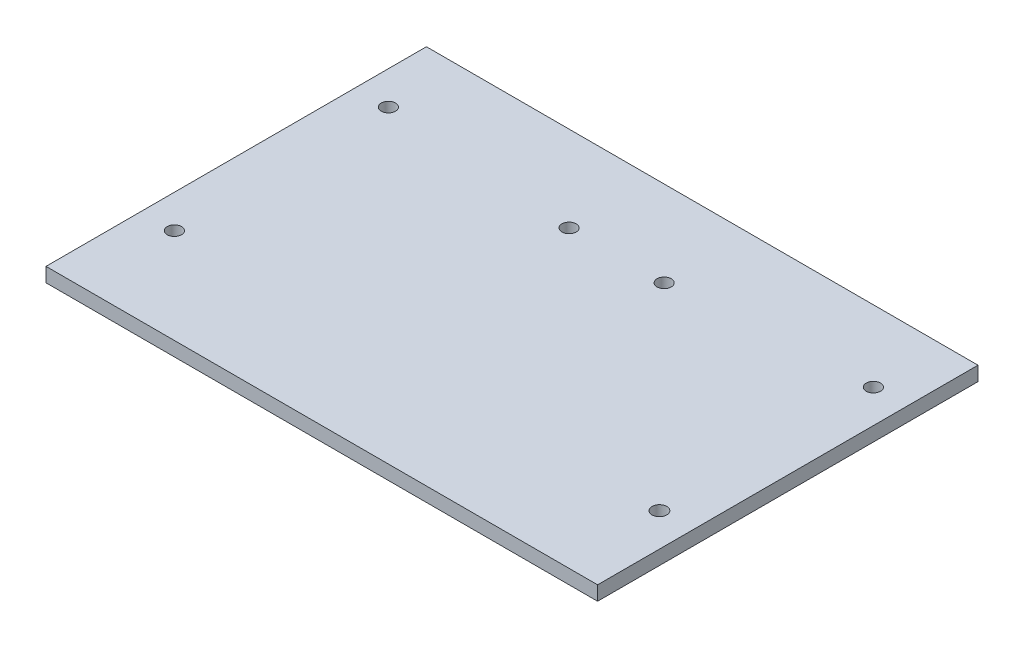
from build123d import *

# Parameters (mm, degrees)
SKETCH_1_W          = 116
SKETCH_1_H          = 80
EXTRUDE_1_DEPTH     = 3
SKETCH_2_R          = 1.5
SKETCH_2_R_2        = 1.55
CUT_EXTRUDE_1_DEPTH = 10
SKETCH_3_R          = 1.5
CUT_EXTRUDE_2_DEPTH = 71.519500849


with BuildPart() as part:
    # 草图1 → 凸台-拉伸1 (new body)
    with BuildSketch(Plane(origin=(0, 0, 0), x_dir=(1, 0, 0), z_dir=(0, 1, 0))):
        Rectangle(SKETCH_1_W, SKETCH_1_H)
    extrude(amount=EXTRUDE_1_DEPTH)

    # 草图2 → 切除-拉伸1 (cut)
    with BuildSketch(Plane.XZ):
        with Locations((-51, 20)):
            Circle(SKETCH_2_R)
        with Locations((51, 20)):
            Circle(SKETCH_2_R_2)
        with Locations((51, -25)):
            Circle(SKETCH_2_R)
        with Locations((-51, -25)):
            Circle(SKETCH_2_R)
    extrude(amount=-CUT_EXTRUDE_1_DEPTH, mode=Mode.SUBTRACT)

    # 草图3 → 切除-拉伸2 (cut, through all)
    with BuildSketch(Plane(origin=(0, 3, 0), x_dir=(1, 0, 0), z_dir=(0, 1, 0))):
        with Locations((-10, 22)):
            Circle(SKETCH_3_R)
        with Locations((10, 22)):
            Circle(SKETCH_3_R)
    extrude(amount=-CUT_EXTRUDE_2_DEPTH, mode=Mode.SUBTRACT)


solid = part.part
